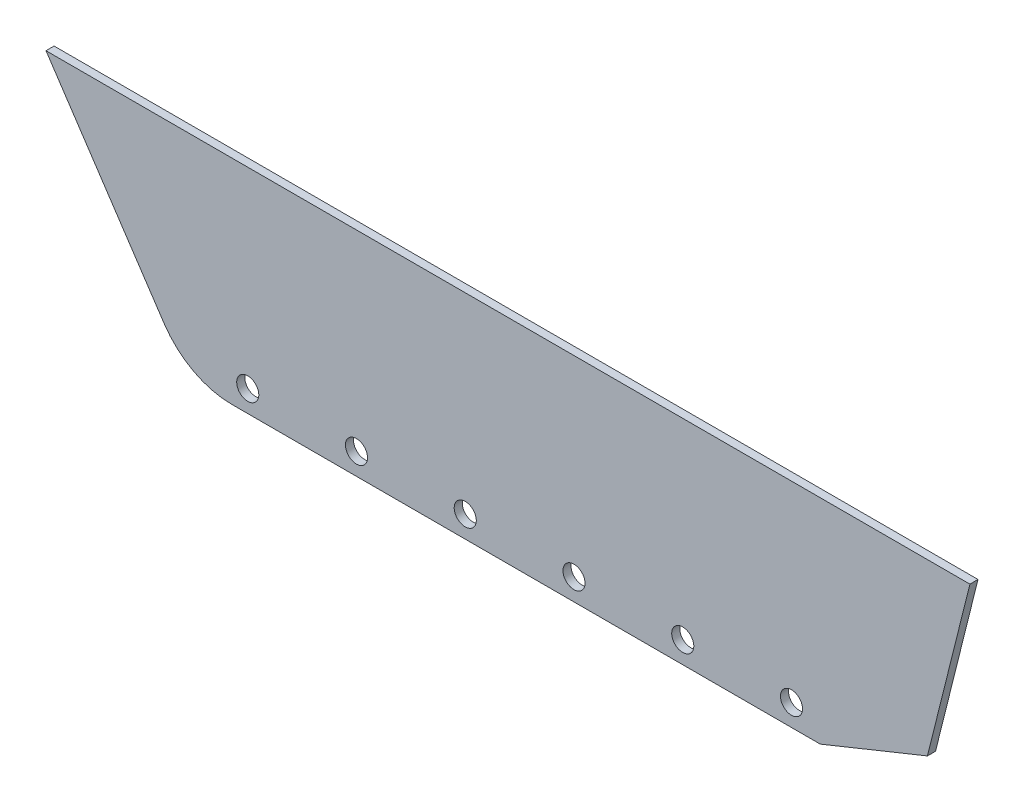
from build123d import *

# Parameters (mm, degrees)
BOSS_EXTRUDE1_DEPTH = 4.7625
SKETCH1_4_R         = 6.5
CUT_EXTRUDE1_DEPTH  = 439.920211962
FILLET1_R           = 48
CUT_EXTRUDE3_DEPTH  = 10


with BuildPart() as part:
    # Sketch1 → Boss-Extrude1 (new body)
    with BuildSketch(Plane.XY):
        Polygon((428.120588235, 28.939617947), (0.540381846, 28.939617947), (-115.605170134, 28.939617947), (-98.879411765, 3.850980392), (-31.879411765, -96.649019608), (366, -96.649019608), (403.120588235, -71.149019608), align=None)
    extrude(amount=BOSS_EXTRUDE1_DEPTH)

    # Sketch1<4> → Cut-Extrude1 (cut, through all)
    with BuildSketch(Plane.XY):
        with Locations((3.120588235, -83.899019608)):
            Circle(SKETCH1_4_R)
        with Locations((67.120588235, -83.899019608)):
            Circle(SKETCH1_4_R)
        with Locations((131.120588235, -83.899019608)):
            Circle(SKETCH1_4_R)
        with Locations((195.120588235, -83.899019608)):
            Circle(SKETCH1_4_R)
        with Locations((259.120588235, -83.899019608)):
            Circle(SKETCH1_4_R)
        with Locations((323.120588235, -83.899019608)):
            Circle(SKETCH1_4_R)
    extrude(amount=CUT_EXTRUDE1_DEPTH, mode=Mode.SUBTRACT)

    # Fillet1
    fillet1_edges = [part.edges().sort_by_distance(p)[0] for p in [
        (-31.879411765, -96.649019608, 2.38125),
    ]]
    fillet(fillet1_edges, radius=FILLET1_R)

    # Sketch7 → Cut-Extrude3 (cut)
    with BuildSketch(Plane.XY.offset(4.7625)):
        Polygon((403.120588235, -71.149019608), (340.005873473, -96.649019608), (366, -96.649019608), align=None)
    extrude(amount=-CUT_EXTRUDE3_DEPTH, mode=Mode.SUBTRACT)


solid = part.part
